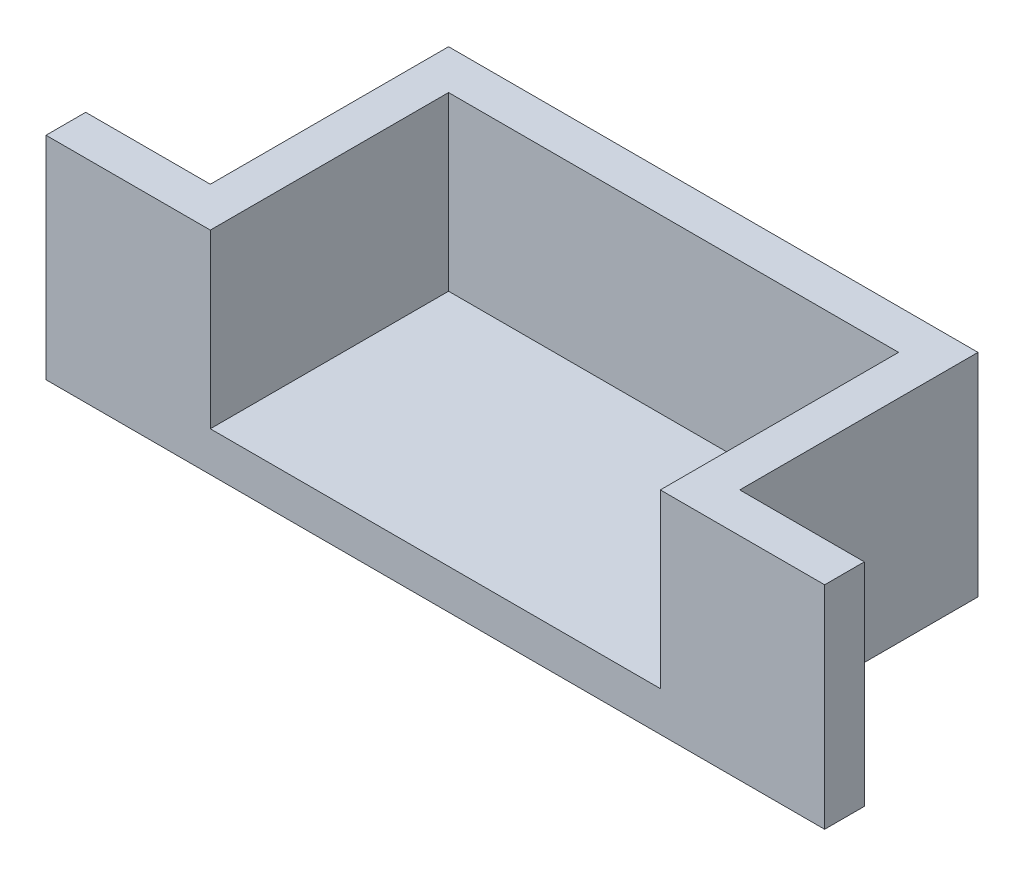
from build123d import *

# Parameters (mm, degrees)
BOSS_EXTRUDE1_DEPTH = 16
SKETCH2_W           = 34
SKETCH2_H           = 18
BOSS_EXTRUDE2_DEPTH = 3


with BuildPart() as part:
    # Sketch1 → Boss-Extrude1 (new body)
    with BuildSketch(Plane(origin=(0, 0, 0), x_dir=(1, 0, 0), z_dir=(0, 1, 0))):
        Polygon((-20, 7.942528736), (-20, -10.057471264), (-29.413793103, -10.057471264), (-29.413793103, -13.057471264), (-17, -13.057471264), (-17, 4.942528736), (17, 4.942528736), (17, -13.057471264), (29.413793103, -13.057471264), (29.413793103, -10.057471264), (20, -10.057471264), (20, 7.942528736), align=None)
    extrude(amount=BOSS_EXTRUDE1_DEPTH)

    # Sketch2 → Boss-Extrude2 (add)
    with BuildSketch(Plane(origin=(0, 0, 0), x_dir=(1, 0, 0), z_dir=(0, 1, 0))):
        with Locations((0, -4.057471264)):
            Rectangle(SKETCH2_W, SKETCH2_H)
    extrude(amount=BOSS_EXTRUDE2_DEPTH)


solid = part.part
